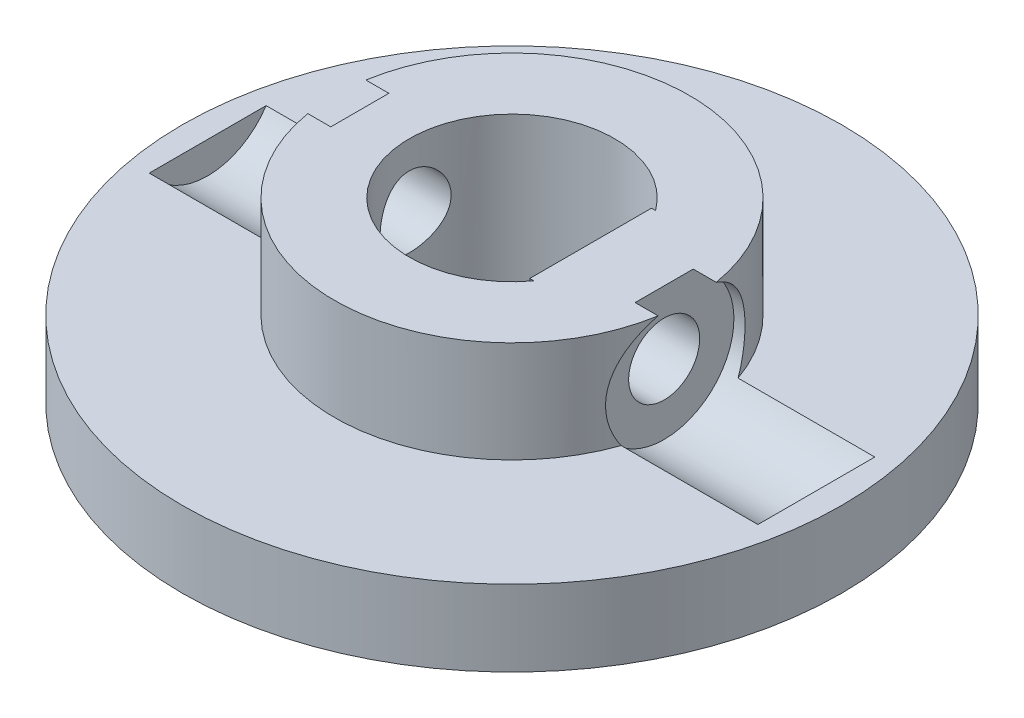
from build123d import *

# Parameters (mm, degrees)
STOCK_HORN_DRIVE_FLANGE_START                 = 41
STOCK_HORN_DRIVE_FLANGE_PROFILE_R             = 13
STOCK_HORN_DRIVE_FLANGE_PROFILE_R_2           = 4.05
STOCK_HORN_DRIVE_FLANGE_DEPTH                 = 3
D_COUPLING_RING_START                         = 44
D_COUPLING_RING_PROFILE_R                     = 7
D_COUPLING_RING_PROFILE_R_2                   = 4.05
D_COUPLING_RING_DEPTH                         = 4
D_KEY_LAND_START                              = 44
D_KEY_LAND_PROFILE_W                          = 2.9
D_KEY_LAND_PROFILE_H                          = 4.8
D_KEY_LAND_DEPTH                              = 4
YAW_POSITIVE_RETENTION_CROSSBOLT_START        = -10
YAW_POSITIVE_RETENTION_CROSSBOLT_PROFILE_R    = 1.1
YAW_POSITIVE_RETENTION_CROSSBOLT_DEPTH        = 62.400389104
CROSSBOLT_FLAT_SEAT_CUT_12_START              = -12
CROSSBOLT_FLAT_SEAT_12_R                      = 2.75
CROSSBOLT_FLAT_SEAT_CUT_12_DEPTH              = 6
CROSSBOLT_FLAT_SEAT_CUT_6_START               = 6
CROSSBOLT_FLAT_SEAT_6_R                       = 2.75
CROSSBOLT_FLAT_SEAT_CUT_6_DEPTH               = 6
SG90_SPLINE_SOCKET_BOSS_OD12_START            = 37.3
SG90_SPLINE_SOCKET_BOSS_PROFILE_R             = 6
SG90_SPLINE_SOCKET_BOSS_OD12_DEPTH            = 3.7
SG90_SPLINE_PRESS_SOCKET_D4P85_DEPTH2P5_START = 37.3
SG90_SPLINE_PRESS_SOCKET_D4P85_DEPTH_2_R      = 2.425
SG90_SPLINE_PRESS_SOCKET_D4P85_DEPTH2P5_DEPTH = 2.5
SG90_CENTRE_SCREW_CLEARANCE_D2P4_START        = 39.8
SG90_CENTRE_SCREW_CLEARANCE_D2P4_PROFILE_R    = 1.2
SG90_CENTRE_SCREW_CLEARANCE_D2P4_DEPTH        = 1.2
CROSSBOLT_AXIAL_FLOAT_CLEARANCE_D2P8_START    = -10
CROSSBOLT_AXIAL_FLOAT_CLEARANCE_D2P8_PRO_R    = 1.4
CROSSBOLT_AXIAL_FLOAT_CLEARANCE_D2P8_DEPTH    = 62.400389197


with BuildPart() as part:
    # Stock_horn_drive_flange_profile → Stock_horn_drive_flange (new body)
    with BuildSketch(Plane(origin=(0, 0, 0), x_dir=(1, 0, 0), z_dir=(0, 1, 0)).offset(STOCK_HORN_DRIVE_FLANGE_START)):
        Circle(STOCK_HORN_DRIVE_FLANGE_PROFILE_R)
        Circle(STOCK_HORN_DRIVE_FLANGE_PROFILE_R_2, mode=Mode.SUBTRACT)
    extrude(amount=STOCK_HORN_DRIVE_FLANGE_DEPTH)

    # D_coupling_ring_profile → D_coupling_ring (add)
    with BuildSketch(Plane(origin=(0, 0, 0), x_dir=(1, 0, 0), z_dir=(0, 1, 0)).offset(D_COUPLING_RING_START)):
        Circle(D_COUPLING_RING_PROFILE_R)
        Circle(D_COUPLING_RING_PROFILE_R_2, mode=Mode.SUBTRACT)
    extrude(amount=D_COUPLING_RING_DEPTH)

    # D_key_land_profile → D_key_land (add)
    with BuildSketch(Plane(origin=(0, 0, 0), x_dir=(1, 0, 0), z_dir=(0, 1, 0)).offset(D_KEY_LAND_START)):
        with Locations((4.55, 0)):
            Rectangle(D_KEY_LAND_PROFILE_W, D_KEY_LAND_PROFILE_H)
    extrude(amount=D_KEY_LAND_DEPTH)

    # Yaw_positive_retention_crossbolt_profile → Yaw_positive_retention_crossbolt (cut, through all)
    with BuildSketch(Plane(origin=(0, 0, 0), x_dir=(0, 0, -1), z_dir=(1, 0, 0)).offset(YAW_POSITIVE_RETENTION_CROSSBOLT_START)):
        with Locations((0, 45.5)):
            Circle(YAW_POSITIVE_RETENTION_CROSSBOLT_PROFILE_R)
    extrude(amount=YAW_POSITIVE_RETENTION_CROSSBOLT_DEPTH, mode=Mode.SUBTRACT)

    # Crossbolt_flat_seat_-12 → Crossbolt_flat_seat_cut_-12 (cut)
    with BuildSketch(Plane(origin=(0, 0, 0), x_dir=(0, 0, -1), z_dir=(1, 0, 0)).offset(CROSSBOLT_FLAT_SEAT_CUT_12_START)):
        with Locations((0, 45.5)):
            Circle(CROSSBOLT_FLAT_SEAT_12_R)
    extrude(amount=CROSSBOLT_FLAT_SEAT_CUT_12_DEPTH, mode=Mode.SUBTRACT)

    # Crossbolt_flat_seat_6 → Crossbolt_flat_seat_cut_6 (cut)
    with BuildSketch(Plane(origin=(0, 0, 0), x_dir=(0, 0, -1), z_dir=(1, 0, 0)).offset(CROSSBOLT_FLAT_SEAT_CUT_6_START)):
        with Locations((0, 45.5)):
            Circle(CROSSBOLT_FLAT_SEAT_6_R)
    extrude(amount=CROSSBOLT_FLAT_SEAT_CUT_6_DEPTH, mode=Mode.SUBTRACT)

    # SG90_spline_socket_boss_profile → SG90_spline_socket_boss_OD12 (add)
    with BuildSketch(Plane(origin=(0, 0, 0), x_dir=(1, 0, 0), z_dir=(0, 1, 0)).offset(SG90_SPLINE_SOCKET_BOSS_OD12_START)):
        Circle(SG90_SPLINE_SOCKET_BOSS_PROFILE_R)
    extrude(amount=SG90_SPLINE_SOCKET_BOSS_OD12_DEPTH)

    # SG90_spline_press_socket_D4p85_depth 2 → SG90_spline_press_socket_D4p85_depth2p5 (cut)
    with BuildSketch(Plane(origin=(0, 0, 0), x_dir=(1, 0, 0), z_dir=(0, 1, 0)).offset(SG90_SPLINE_PRESS_SOCKET_D4P85_DEPTH2P5_START)):
        Circle(SG90_SPLINE_PRESS_SOCKET_D4P85_DEPTH_2_R)
    extrude(amount=SG90_SPLINE_PRESS_SOCKET_D4P85_DEPTH2P5_DEPTH, mode=Mode.SUBTRACT)

    # SG90_centre_screw_clearance_D2p4_profile → SG90_centre_screw_clearance_D2p4 (cut)
    with BuildSketch(Plane(origin=(0, 0, 0), x_dir=(1, 0, 0), z_dir=(0, 1, 0)).offset(SG90_CENTRE_SCREW_CLEARANCE_D2P4_START)):
        Circle(SG90_CENTRE_SCREW_CLEARANCE_D2P4_PROFILE_R)
    extrude(amount=SG90_CENTRE_SCREW_CLEARANCE_D2P4_DEPTH, mode=Mode.SUBTRACT)

    # Crossbolt_axial_float_clearance_D2p8_profile → Crossbolt_axial_float_clearance_D2p8 (cut, through all)
    with BuildSketch(Plane(origin=(0, 0, 0), x_dir=(0, 0, -1), z_dir=(1, 0, 0)).offset(CROSSBOLT_AXIAL_FLOAT_CLEARANCE_D2P8_START)):
        with Locations((0, 45.5)):
            Circle(CROSSBOLT_AXIAL_FLOAT_CLEARANCE_D2P8_PRO_R)
    extrude(amount=CROSSBOLT_AXIAL_FLOAT_CLEARANCE_D2P8_DEPTH, mode=Mode.SUBTRACT)


solid = part.part
